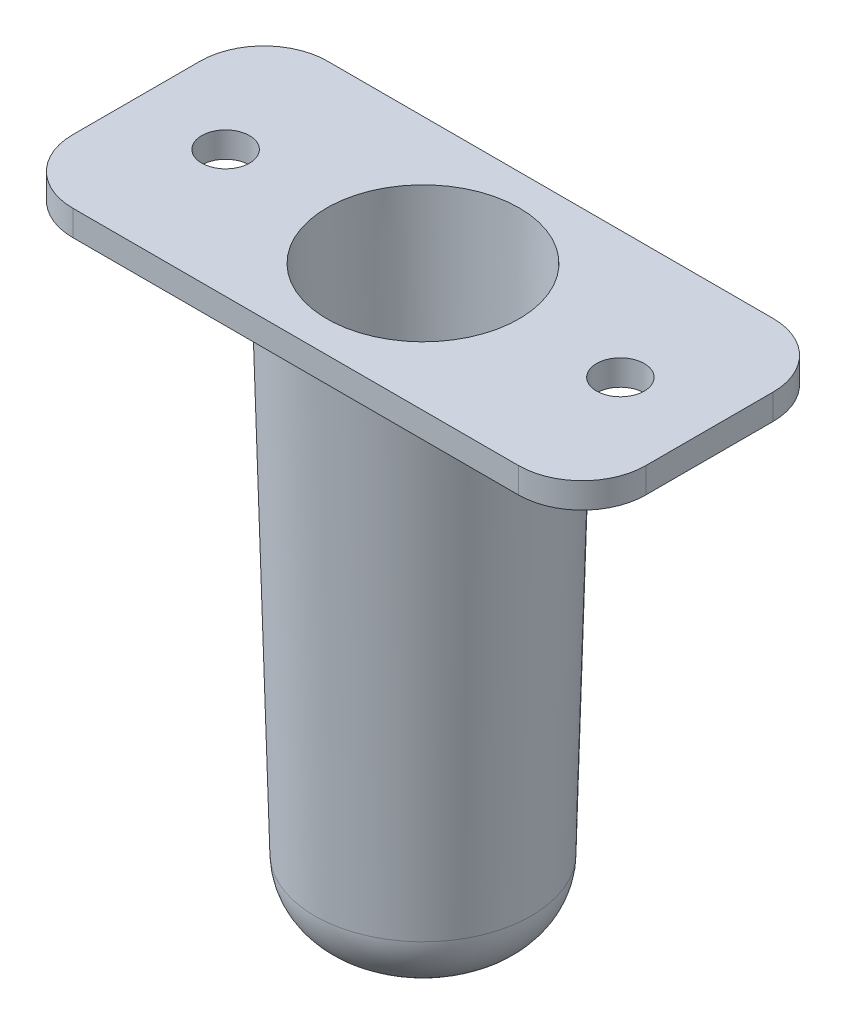
from build123d import *

# Parameters (mm, degrees)
BOSS_EXTRUDE1_DEPTH = 2.54
SKETCH2_R           = 12.065
BOSS_EXTRUDE2_DEPTH = 54.61
DRAFT2_ANGLE        = 1.5
FILLET2_R           = 6.35
CUT_EXTRUDE1_REACH  = 64.929
SKETCH3_R           = 2.38125


# Read off the part's stored shape, not the designer's step: Shell1
with BuildPart() as part:
    # Sketch1 → Boss-Extrude1 (new body)
    with BuildSketch(Plane(origin=(0, 0, 0), x_dir=(1, 0, 0), z_dir=(0, 1, 0))):
        with BuildLine():
            Line((-22.225, -12.7), (22.225, -12.7))
            ThreePointArc((22.225, -12.7), (26.715128061, -10.840128061), (28.575, -6.35))
            Line((28.575, -6.35), (28.575, 6.35))
            ThreePointArc((28.575, 6.35), (26.715128061, 10.840128061), (22.225, 12.7))
            Line((22.225, 12.7), (-22.225, 12.7))
            ThreePointArc((-22.225, 12.7), (-26.715128061, 10.840128061), (-28.575, 6.35))
            Line((-28.575, 6.35), (-28.575, -6.35))
            ThreePointArc((-28.575, -6.35), (-26.715128061, -10.840128061), (-22.225, -12.7))
        make_face()
    extrude(amount=BOSS_EXTRUDE1_DEPTH)

    # Sketch2 → Boss-Extrude2 (add)
    with BuildSketch(Plane.XZ):
        with Locations(Location((0, 0, 0), (0, 0, 270))):
            Circle(SKETCH2_R)
    extrude(amount=BOSS_EXTRUDE2_DEPTH)

    # Draft2
    draft2_faces = [part.faces().sort_by_distance(p)[0] for p in [
        (0, -27.305, 12.065),
    ]]
    draft(draft2_faces, Plane(origin=(22.225, 0, 6.35), x_dir=(0, 0, -1), z_dir=(0, -1, 0)), DRAFT2_ANGLE)

    # Fillet2
    fillet2_edges = [part.edges().sort_by_distance(p)[0] for p in [
        (0, -54.61, 10.634986823),
    ]]
    fillet(fillet2_edges, radius=FILLET2_R)

    # Shell1 outline → Shell1 (revolve, cut)
    with BuildSketch(Plane.XY):
        with BuildLine():
            ThreePointArc((4.449090693, -52.07), (7.107672345, -50.989110404), (8.257785101, -48.359734173))
            Line((8.257785101, -48.359734173), (9.590641548, 2.54))
            Line((9.590641548, 2.54), (0, 2.54))
            Line((0, 2.54), (0, -52.07))
            Line((0, -52.07), (4.449090693, -52.07))
        make_face()
    revolve(axis=Axis((0, 0, 0), (0, 1, 0)), mode=Mode.SUBTRACT)

    # Sketch3 → Cut-Extrude1 (cut, up to next)
    with BuildSketch(Plane.XZ, mode=Mode.PRIVATE) as cut_extrude1_sk1:
        with Locations(Location((19.685, 0, 0), (0, 0, 270))):
            Circle(SKETCH3_R)
    cut_extrude1_tool1 = extrude(cut_extrude1_sk1.sketch, amount=-CUT_EXTRUDE1_REACH, mode=Mode.PRIVATE) & part.part
    cut_extrude1 = cut_extrude1_tool1.solids().sort_by_distance((19.685, 0, 0))[0]
    add(cut_extrude1, mode=Mode.SUBTRACT)

    # Mirror1: Cut-Extrude1 across plane
    add(cut_extrude1.mirror(Plane(origin=(0, 0, 0), x_dir=(0, 0, 1), z_dir=(1, 0, 0))), mode=Mode.SUBTRACT)


solid = part.part
